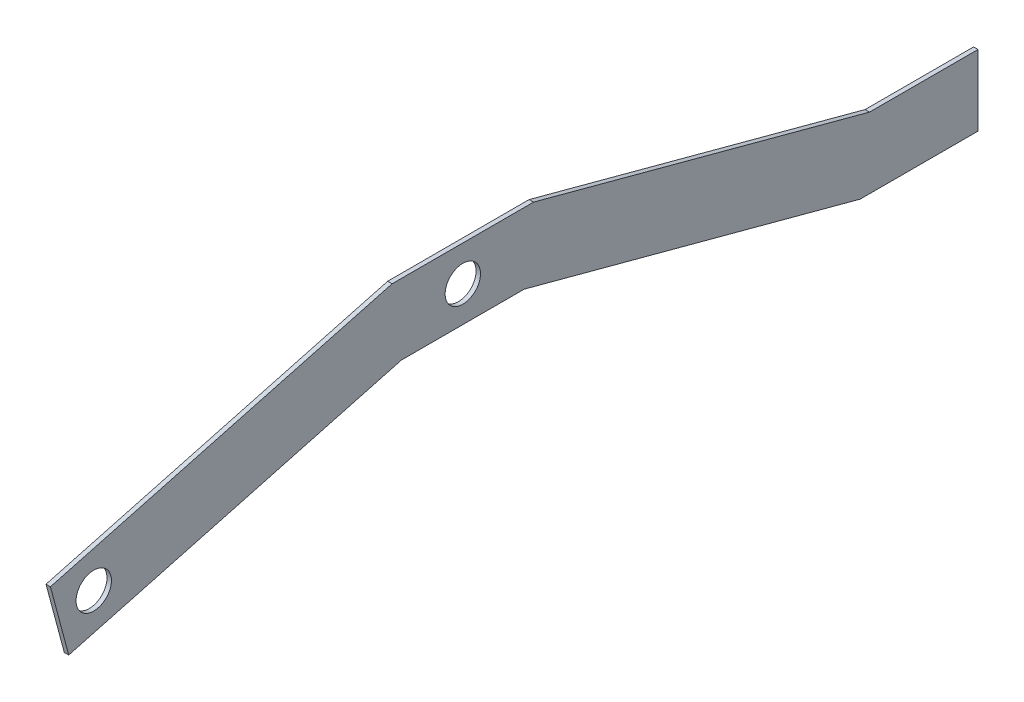
from build123d import *

# Parameters (mm, degrees)
SKETCH1_R           = 12.7
BOSS_EXTRUDE1_DEPTH = 3.175
SKETCH3_R           = 12.7
CUT_EXTRUDE2_DEPTH  = 501.923776165
SKETCH5_W           = 50.8
SKETCH5_H           = 247.65
CUT_EXTRUDE4_DEPTH  = 501.923776165
SKETCH6_W           = 127
SKETCH6_H           = 25.4
CUT_EXTRUDE5_DEPTH  = 384.019234201
BOSS_EXTRUDE2_DEPTH = 3.175


with BuildPart() as part:
    # Sketch1 → Boss-Extrude1 (new body)
    with BuildSketch(Plane(origin=(0, 0, 0), x_dir=(0, 0, -1), z_dir=(1, 0, 0))):
        Polygon((-50.8, 25.4), (50.8, 25.4), (369.963359856, -60.119564527), (369.963359856, -337.700549698), (319.163359856, -337.700549698), (319.163359856, -99.099775516), (44.112053123, -25.4), (-44.112053123, -25.4), (-282.997152386, -89.409069432), (-296.145159877, -40.340037456), align=None)
        with Locations((-265.036640144, -58.300549698)):
            Circle(SKETCH1_R, mode=Mode.SUBTRACT)
        Circle(SKETCH1_R, mode=Mode.SUBTRACT)
    extrude(amount=BOSS_EXTRUDE1_DEPTH)

    # Sketch3 → Cut-Extrude2 (cut, through all)
    with BuildSketch(Plane(origin=(3.175, 0, 0), x_dir=(0, 0, -1), z_dir=(1, 0, 0))):
        with Locations((344.563359856, -312.300549698)):
            Circle(SKETCH3_R)
    extrude(amount=-CUT_EXTRUDE2_DEPTH, mode=Mode.SUBTRACT)

    # Sketch5 → Cut-Extrude4 (cut, through all)
    with BuildSketch(Plane(origin=(3.175, 0, 0), x_dir=(0, 0, -1), z_dir=(1, 0, 0))):
        with Locations((344.563359856, -213.875549698)):
            Rectangle(SKETCH5_W, SKETCH5_H)
    extrude(amount=-CUT_EXTRUDE4_DEPTH, mode=Mode.SUBTRACT)

    # Sketch6 → Cut-Extrude5 (cut, through all)
    with BuildSketch(Plane(origin=(3.175, 0, 0), x_dir=(0, 0, -1), z_dir=(1, 0, 0))):
        with Locations((306.463359856, -102.750549698)):
            Rectangle(SKETCH6_W, SKETCH6_H)
    extrude(amount=-CUT_EXTRUDE5_DEPTH, mode=Mode.SUBTRACT)

    # Sketch7 → Boss-Extrude2 (add)
    with BuildSketch(Plane(origin=(3.175, 0, 0), x_dir=(0, 0, -1), z_dir=(1, 0, 0))):
        Polygon((292.079136211, -39.250549698), (369.963359856, -39.250549698), (369.963359856, -60.119564527), align=None)
    extrude(amount=-BOSS_EXTRUDE2_DEPTH)


solid = part.part
